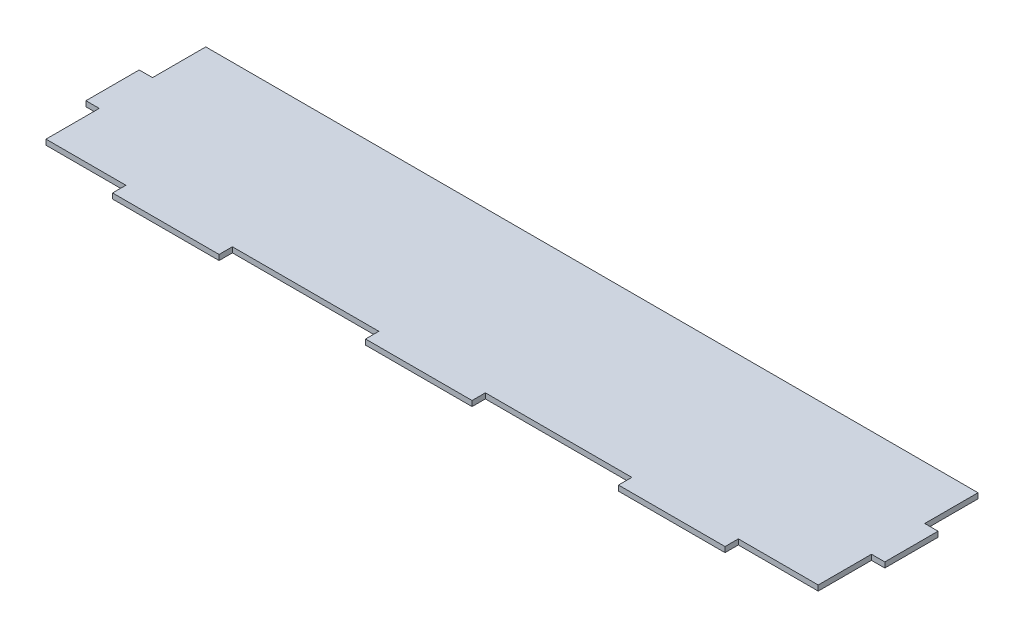
from build123d import *

# Parameters (mm, degrees)
BOSS_EXTRUDE1_DEPTH = 2.54
SHELL1_START        = 6.4516
SHELL1_OUTLINE_W    = 2.3368
SHELL1_OUTLINE_H    = 75.9968
SHELL1_DEPTH        = 368.0968
SHELL1_START_2      = 44.5516
SHELL1_2_OUTLINE_W  = 2.3368
SHELL1_2_OUTLINE_H  = 6.35
SHELL1_2_DEPTH      = 50.5968
SHELL1_START_3      = 165.2016
SHELL1_3_OUTLINE_W  = 2.3368
SHELL1_3_OUTLINE_H  = 6.35
SHELL1_3_DEPTH      = 50.5968
SHELL1_START_4      = 285.8516
SHELL1_4_OUTLINE_W  = 2.3368
SHELL1_4_OUTLINE_H  = 6.35
SHELL1_4_DEPTH      = 50.5968
SHELL1_START_5      = 0.1016
SHELL1_5_OUTLINE_W  = 2.3368
SHELL1_5_OUTLINE_H  = 25.1968
SHELL1_5_DEPTH      = 380.7968


# Read off the part's stored shape, not the designer's step: Shell1
with BuildPart() as part:
    # Sketch1 → Boss-Extrude1 (new body)
    with BuildSketch(Plane(origin=(0, 0, 0), x_dir=(1, 0, 0), z_dir=(0, 1, 0))):
        Polygon((0, 12.434013317), (0, -12.965986683), (6.35, -12.965986683), (6.35, -38.365986683), (44.45, -38.365986683), (44.45, -44.715986683), (95.25, -44.715986683), (95.25, -38.365986683), (165.1, -38.365986683), (165.1, -44.715986683), (215.9, -44.715986683), (215.9, -38.365986683), (285.75, -38.365986683), (285.75, -44.715986683), (336.55, -44.715986683), (336.55, -38.365986683), (374.65, -38.365986683), (374.65, -12.965986683), (381, -12.965986683), (381, 12.434013317), (374.65, 12.434013317), (374.65, 37.834013317), (6.35, 37.834013317), (6.35, 12.434013317), align=None)
    extrude(amount=BOSS_EXTRUDE1_DEPTH)

    # Shell1 outline → Shell1 (cut)
    with BuildSketch(Plane.YZ.offset(SHELL1_START)):
        with Locations((1.27, 0.265986683)):
            Rectangle(SHELL1_OUTLINE_W, SHELL1_OUTLINE_H)
    extrude(amount=SHELL1_DEPTH, mode=Mode.SUBTRACT)

    # Shell1 2 outline → Shell1 2 (cut)
    with BuildSketch(Plane.YZ.offset(SHELL1_START_2)):
        with Locations((1.27, 41.439386683)):
            Rectangle(SHELL1_2_OUTLINE_W, SHELL1_2_OUTLINE_H)
    extrude(amount=SHELL1_2_DEPTH, mode=Mode.SUBTRACT)

    # Shell1 3 outline → Shell1 3 (cut)
    with BuildSketch(Plane.YZ.offset(SHELL1_START_3)):
        with Locations((1.27, 41.439386683)):
            Rectangle(SHELL1_3_OUTLINE_W, SHELL1_3_OUTLINE_H)
    extrude(amount=SHELL1_3_DEPTH, mode=Mode.SUBTRACT)

    # Shell1 4 outline → Shell1 4 (cut)
    with BuildSketch(Plane.YZ.offset(SHELL1_START_4)):
        with Locations((1.27, 41.439386683)):
            Rectangle(SHELL1_4_OUTLINE_W, SHELL1_4_OUTLINE_H)
    extrude(amount=SHELL1_4_DEPTH, mode=Mode.SUBTRACT)

    # Shell1 5 outline → Shell1 5 (cut)
    with BuildSketch(Plane.YZ.offset(SHELL1_START_5)):
        with Locations((1.27, 0.265986683)):
            Rectangle(SHELL1_5_OUTLINE_W, SHELL1_5_OUTLINE_H)
    extrude(amount=SHELL1_5_DEPTH, mode=Mode.SUBTRACT)


solid = part.part
